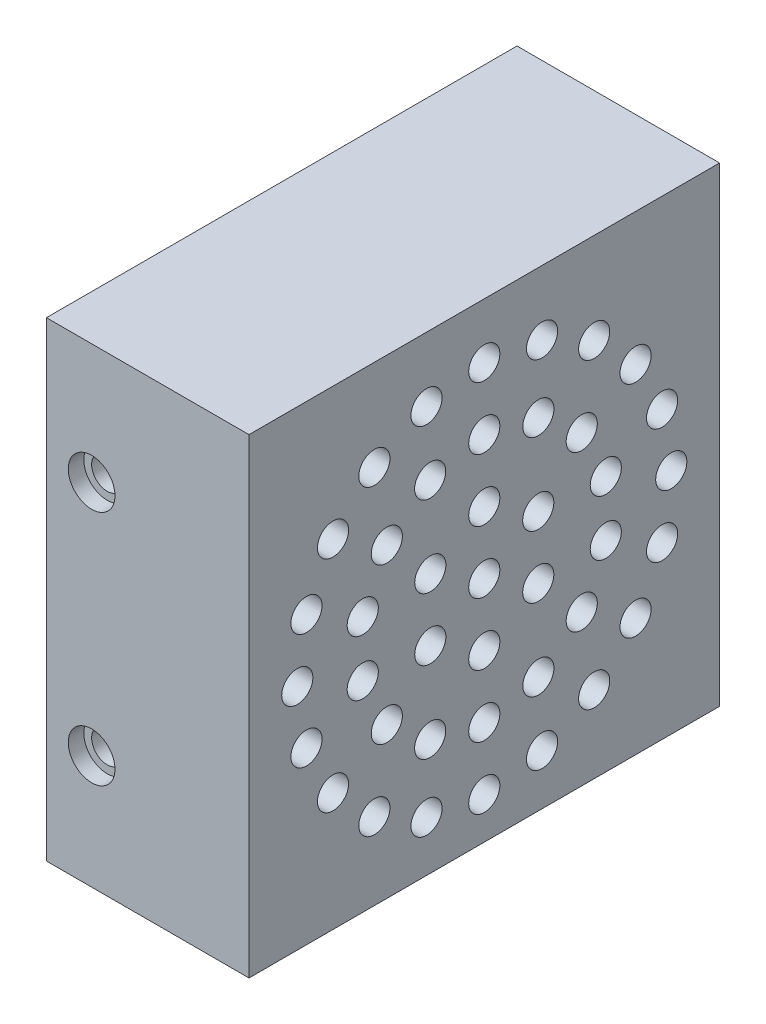
from build123d import *
from build123d.topology import SkipClean

# Parameters (mm, degrees)
SKETCH_1_W          = 3.0000000000000027
SKETCH_1_H          = 26
EXTRUDE_1_DEPTH     = 21.2
EXTRUDE_2_DEPTH     = 3
SKETCH_2_R          = 14.3
CUT_EXTRUDE_1_DEPTH = 1
EXTRUDE_START       = 3
EXTRUDE_3_DEPTH     = 3
EXTRUDE_START_2     = 10
EXTRUDE_4_DEPTH     = 7
SKETCH_7_R          = 1.0000000000000018
SKETCH_7_R_2        = 1.0000000000000016
CUT_EXTRUDE_2_DEPTH = 42.41376582731883
SKETCH_7_3_R        = 1.5000000000000009
SKETCH_7_3_R_2      = 1.0000000000000018
SKETCH_7_3_R_3      = 1.5000000000000004
SKETCH_7_3_R_4      = 1.0000000000000016
CUT_EXTRUDE_3_DEPTH = 1
CUT_EXTRUDE_START   = -29.2
SKETCH_7_4_R        = 1.5000000000000009
SKETCH_7_4_R_2      = 1.0000000000000018
SKETCH_7_4_R_3      = 1.5000000000000004
SKETCH_7_4_R_4      = 1.0000000000000016
CUT_EXTRUDE_4_DEPTH = 1
OTHER_START         = -0.5
OTHER_1_OUTLINE_R   = 1
OTHER_1_DEPTH       = 2


# Read off the part's stored shape, not the designer's step: 填充阵列1
with BuildPart() as part:
    # 草图1 → 凸台-拉伸1 (new body)
    with BuildSketch(Plane(origin=(0, 0, 0), x_dir=(1, 0, 0), z_dir=(0, 1, 0))):
        Rectangle(SKETCH_1_W, SKETCH_1_H)
    extrude(amount=EXTRUDE_1_DEPTH)

    # 草图5 → 凸台-拉伸2 (add)
    with BuildSketch(Plane(origin=(1.5000000000000013, 0, 0), x_dir=(0, 0, -1), z_dir=(1, 0, 0))):
        Polygon((-15.100000000000001, 25.9), (15.099999999999998, 25.900000000000002), (15.100000000000001, -4.299999999999996), (-15.099999999999998, -4.3), align=None)
    extrude(amount=-EXTRUDE_2_DEPTH)

    # 草图2 → 切除-拉伸1 (cut)
    with BuildSketch(Plane.ZY.offset(1.5000000000000013)):
        with Locations((1.8546e-13, 10.35000000000003)):
            Circle(SKETCH_2_R)
    extrude(amount=-CUT_EXTRUDE_1_DEPTH, mode=Mode.SUBTRACT)

    # 草图6 → 凸台-拉伸3 (add)
    with SkipClean():  # the faces are left unmerged after this step: merging them gives an invalid solid
        with BuildSketch(Plane.ZY.offset(1.5000000000000013).offset(EXTRUDE_START)):
            with BuildLine():
                Line((15.100000000000001, 25.9), (-15.099999999999998, 25.9))
                Line((-15.099999999999998, 25.9), (-15.099999999999994, 21.4))
                Line((-15.099999999999994, 21.4), (-13.099999999999994, 21.4))
                Line((-13.099999999999994, 21.4), (-9.076756028450045, 21.4))
                ThreePointArc((-9.07675602844997, 21.39999999999975), (-2.1374e-13, 24.65000000000003), (9.076756028449726, 21.400000000000254))
                Line((9.076756028449651, 21.4), (13.100000000000001, 21.4))
                Line((13.100000000000001, 21.4), (15.100000000000001, 21.4))
                Line((15.100000000000001, 21.4), (15.100000000000001, 25.9))
            make_face()
            with BuildLine():
                Line((-13.099999999999994, 21.4), (-15.099999999999994, 21.4))
                Line((-15.099999999999994, 21.4), (-15.099999999999994, -4.3))
                Line((-15.099999999999994, -4.3), (-13.099999999999994, -4.3))
                Line((-13.099999999999994, -4.3), (-13.099999999999994, 4.615891525267789))
                ThreePointArc((-13.099999999999968, 4.615891525267795), (-14.299999999999816, 10.350000000000032), (-13.099999999999962, 16.084108474732275))
                Line((-13.099999999999994, 16.084108474732275), (-13.099999999999994, 21.4))
            make_face()
            with BuildLine():
                Line((-9.076756028450045, 21.4), (-13.099999999999994, 21.4))
                Line((-13.099999999999994, 21.4), (-13.099999999999994, 16.084108474732275))
                ThreePointArc((-13.099999999999962, 16.084108474732275), (-11.4024910727196, 18.979785474537948), (-9.07675602844997, 21.39999999999975))
            make_face()
            with BuildLine():
                Line((13.100000000000001, 16.084108474732616), (13.100000000000001, 21.4))
                Line((13.100000000000001, 21.4), (9.076756028449651, 21.4))
                ThreePointArc((9.076756028449726, 21.400000000000254), (11.402491072719606, 18.97978547453843), (13.100000000000168, 16.084108474732652))
            make_face()
            with BuildLine():
                Line((15.100000000000001, -4.3), (15.100000000000001, 21.4))
                Line((15.100000000000001, 21.4), (13.100000000000001, 21.4))
                Line((13.100000000000001, 21.4), (13.100000000000001, 16.084108474732616))
                ThreePointArc((13.100000000000168, 16.084108474732652), (13.996785345214274, 13.279163703175414), (14.300000000000185, 10.35000000000003))
                ThreePointArc((14.300000000000185, 10.350000000000026), (13.996785345214237, 7.420836296824469), (13.100000000000025, 4.615891525267081))
                Line((13.100000000000001, 4.6158915252670925), (13.100000000000001, -4.3))
                Line((13.100000000000001, -4.3), (15.100000000000001, -4.3))
            make_face()
            with BuildLine():
                Line((-13.099999999999994, 4.615891525267789), (-13.099999999999994, -4.3))
                Line((-13.099999999999994, -4.299999999999996), (13.100000000000001, -4.3))
                Line((13.100000000000001, -4.3), (13.100000000000001, 4.6158915252670925))
                ThreePointArc((13.100000000000025, 4.615891525267081), (-1.982e-13, -3.949999999999971), (-13.099999999999968, 4.615891525267795))
            make_face()
        extrude(amount=-EXTRUDE_3_DEPTH)

    # 草图6<3> → 凸台-拉伸4 (add)
    with BuildSketch(Plane.ZY.offset(1.5000000000000013).offset(EXTRUDE_START_2)):
        with BuildLine():
            Line((15.100000000000001, 25.9), (-15.099999999999998, 25.9))
            Line((-15.099999999999998, 25.9), (-15.099999999999994, 21.4))
            Line((-15.099999999999994, 21.4), (-13.099999999999994, 21.4))
            Line((-13.099999999999994, 21.4), (-9.076756028450045, 21.4))
            ThreePointArc((-9.07675602844997, 21.39999999999975), (-2.1374e-13, 24.65000000000003), (9.076756028449726, 21.400000000000254))
            Line((9.076756028449651, 21.4), (13.100000000000001, 21.4))
            Line((13.100000000000001, 21.4), (15.100000000000001, 21.4))
            Line((15.100000000000001, 21.4), (15.100000000000001, 25.9))
        make_face()
        with BuildLine():
            Line((-13.099999999999994, 21.4), (-15.099999999999994, 21.4))
            Line((-15.099999999999994, 21.4), (-15.099999999999994, -4.3))
            Line((-15.099999999999994, -4.3), (-13.099999999999994, -4.3))
            Line((-13.099999999999994, -4.3), (-13.099999999999994, 4.615891525267789))
            ThreePointArc((-13.099999999999968, 4.615891525267795), (-14.299999999999816, 10.350000000000032), (-13.099999999999962, 16.084108474732275))
            Line((-13.099999999999994, 16.084108474732275), (-13.099999999999994, 21.4))
        make_face()
        with BuildLine():
            Line((15.100000000000001, -4.3), (15.100000000000001, 21.4))
            Line((15.100000000000001, 21.4), (13.100000000000001, 21.4))
            Line((13.100000000000001, 21.4), (13.100000000000001, 16.084108474732616))
            ThreePointArc((13.100000000000168, 16.084108474732652), (13.996785345214274, 13.279163703175414), (14.300000000000185, 10.35000000000003))
            ThreePointArc((14.300000000000185, 10.350000000000026), (13.996785345214237, 7.420836296824469), (13.100000000000025, 4.615891525267081))
            Line((13.100000000000001, 4.6158915252670925), (13.100000000000001, -4.3))
            Line((13.100000000000001, -4.3), (15.100000000000001, -4.3))
        make_face()
    extrude(amount=-EXTRUDE_4_DEPTH)

    # 草图7 → 切除-拉伸2 (cut, through all)
    with BuildSketch(Plane(origin=(0, 1.73e-15, -15.100000000000001), x_dir=(-1, 0, 0), z_dir=(0, 1.1e-16, -1))):
        with Locations(Location((8.599999999999989, 18.2, 0), (0, 0, 90))):
            Circle(SKETCH_7_R)
        with Locations(Location((8.599999999999989, 3, 0), (0, 0, 90))):
            Circle(SKETCH_7_R_2)
    extrude(amount=-CUT_EXTRUDE_2_DEPTH, mode=Mode.SUBTRACT)

    # 草图7<3> → 切除-拉伸3 (cut)
    # profile 1 of 2: a face of its own
    with BuildSketch(Plane(origin=(0, 1.73e-15, -15.100000000000001), x_dir=(-1, 0, 0), z_dir=(0, 1.1e-16, -1))):
        with Locations(Location((8.599999999999989, 18.2, 0), (0, 0, 90))):
            Circle(SKETCH_7_3_R)
        with Locations(Location((8.599999999999989, 18.2, 0), (0, 0, 90))):
            Circle(SKETCH_7_3_R_2, mode=Mode.SUBTRACT)
    # profile 2 of 2: a face of its own
    with BuildSketch(Plane(origin=(0, 1.73e-15, -15.100000000000001), x_dir=(-1, 0, 0), z_dir=(0, 1.1e-16, -1))):
        with Locations(Location((8.599999999999989, 3, 0), (0, 0, 90))):
            Circle(SKETCH_7_3_R_3)
        with Locations(Location((8.599999999999989, 3, 0), (0, 0, 90))):
            Circle(SKETCH_7_3_R_4, mode=Mode.SUBTRACT)
    extrude(amount=-CUT_EXTRUDE_3_DEPTH, mode=Mode.SUBTRACT)

    # 草图7<4> → 切除-拉伸4 (cut)
    # profile 1 of 2: a face of its own
    with BuildSketch(Plane(origin=(0, 1.73e-15, -15.100000000000001), x_dir=(-1, 0, 0), z_dir=(0, 1.1e-16, -1)).offset(CUT_EXTRUDE_START)):
        with Locations(Location((8.599999999999989, 18.2, 0), (0, 0, 90))):
            Circle(SKETCH_7_4_R)
        with Locations(Location((8.599999999999989, 18.2, 0), (0, 0, 90))):
            Circle(SKETCH_7_4_R_2, mode=Mode.SUBTRACT)
    # profile 2 of 2: a face of its own
    with BuildSketch(Plane(origin=(0, 1.73e-15, -15.100000000000001), x_dir=(-1, 0, 0), z_dir=(0, 1.1e-16, -1)).offset(CUT_EXTRUDE_START)):
        with Locations(Location((8.599999999999989, 3, 0), (0, 0, 90))):
            Circle(SKETCH_7_4_R_3)
        with Locations(Location((8.599999999999989, 3, 0), (0, 0, 90))):
            Circle(SKETCH_7_4_R_4, mode=Mode.SUBTRACT)
    extrude(amount=-CUT_EXTRUDE_4_DEPTH, mode=Mode.SUBTRACT)

    # 填充阵列1 outline → 填充阵列1 (cut)
    with BuildSketch(Plane.YZ.offset(OTHER_START)):
        with Locations((10.35, -3.37e-06)):
            Circle(OTHER_1_OUTLINE_R)
        with Locations((10.35, -12.00000337)):
            Circle(OTHER_1_OUTLINE_R)
        with Locations((6.641796068, -11.412681566)):
            Circle(OTHER_1_OUTLINE_R)
        with Locations((3.296576972, -9.708207303)):
            Circle(OTHER_1_OUTLINE_R)
        with Locations((17.557750943, -3.471073283)):
            Circle(OTHER_1_OUTLINE_R)
        with Locations((14.058203932, -11.412681566)):
            Circle(OTHER_1_OUTLINE_R)
        with Locations((17.403423028, -9.708207303)):
            Circle(OTHER_1_OUTLINE_R)
        with Locations((20.058203932, -7.053426398)):
            Circle(OTHER_1_OUTLINE_R)
        with Locations((21.762678196, -3.708207303)):
            Circle(OTHER_1_OUTLINE_R)
        with Locations((17.403423028, 9.708200562)):
            Circle(OTHER_1_OUTLINE_R)
        with Locations((12.130167472, 7.799419927)):
            Circle(OTHER_1_OUTLINE_R)
        with Locations((6.35, -3.37e-06)):
            Circle(OTHER_1_OUTLINE_R)
        with Locations((20.058203932, 7.053419657)):
            Circle(OTHER_1_OUTLINE_R)
        with Locations((8.35, -3.464104985)):
            Circle(OTHER_1_OUTLINE_R)
        with Locations((8.569832528, 7.799419927)):
            Circle(OTHER_1_OUTLINE_R)
        with Locations((14.058203932, 11.412674825)):
            Circle(OTHER_1_OUTLINE_R)
        with Locations((12.35, -3.464104985)):
            Circle(OTHER_1_OUTLINE_R)
        with Locations((12.35, 3.464098245)):
            Circle(OTHER_1_OUTLINE_R)
        with Locations((22.35, -3.37e-06)):
            Circle(OTHER_1_OUTLINE_R)
        with Locations((18.35, -3.37e-06)):
            Circle(OTHER_1_OUTLINE_R)
        with Locations((14.35, -3.37e-06)):
            Circle(OTHER_1_OUTLINE_R)
        with Locations((17.557750943, 3.471066543)):
            Circle(OTHER_1_OUTLINE_R)
        with Locations((21.762678196, 3.708200562)):
            Circle(OTHER_1_OUTLINE_R)
        with Locations((8.35, 3.464098245)):
            Circle(OTHER_1_OUTLINE_R)
        with Locations((15.337918415, 6.25464849)):
            Circle(OTHER_1_OUTLINE_R)
        with Locations((-1.65, -3.37e-06)):
            Circle(OTHER_1_OUTLINE_R)
        with Locations((8.569832528, -7.799426668)):
            Circle(OTHER_1_OUTLINE_R)
        with Locations((-1.062678196, 3.708200562)):
            Circle(OTHER_1_OUTLINE_R)
        with Locations((5.362081585, -6.25465523)):
            Circle(OTHER_1_OUTLINE_R)
        with Locations((0.641796068, -7.053426398)):
            Circle(OTHER_1_OUTLINE_R)
        with Locations((15.337918415, -6.25465523)):
            Circle(OTHER_1_OUTLINE_R)
        with Locations((-1.062678196, -3.708207303)):
            Circle(OTHER_1_OUTLINE_R)
        with Locations((12.130167472, -7.799426668)):
            Circle(OTHER_1_OUTLINE_R)
        with Locations((6.641796068, 11.412674825)):
            Circle(OTHER_1_OUTLINE_R)
        with Locations((3.142249057, 3.471066543)):
            Circle(OTHER_1_OUTLINE_R)
        with Locations((10.35, 11.99999663)):
            Circle(OTHER_1_OUTLINE_R)
        with Locations((5.362081585, 6.25464849)):
            Circle(OTHER_1_OUTLINE_R)
        with Locations((0.641796068, 7.053419657)):
            Circle(OTHER_1_OUTLINE_R)
        with Locations((3.142249057, -3.471073283)):
            Circle(OTHER_1_OUTLINE_R)
        with Locations((3.296576972, 9.708200562)):
            Circle(OTHER_1_OUTLINE_R)
        with Locations((2.35, -3.37e-06)):
            Circle(OTHER_1_OUTLINE_R)
    extrude(amount=OTHER_1_DEPTH, mode=Mode.SUBTRACT)


solid = part.part
